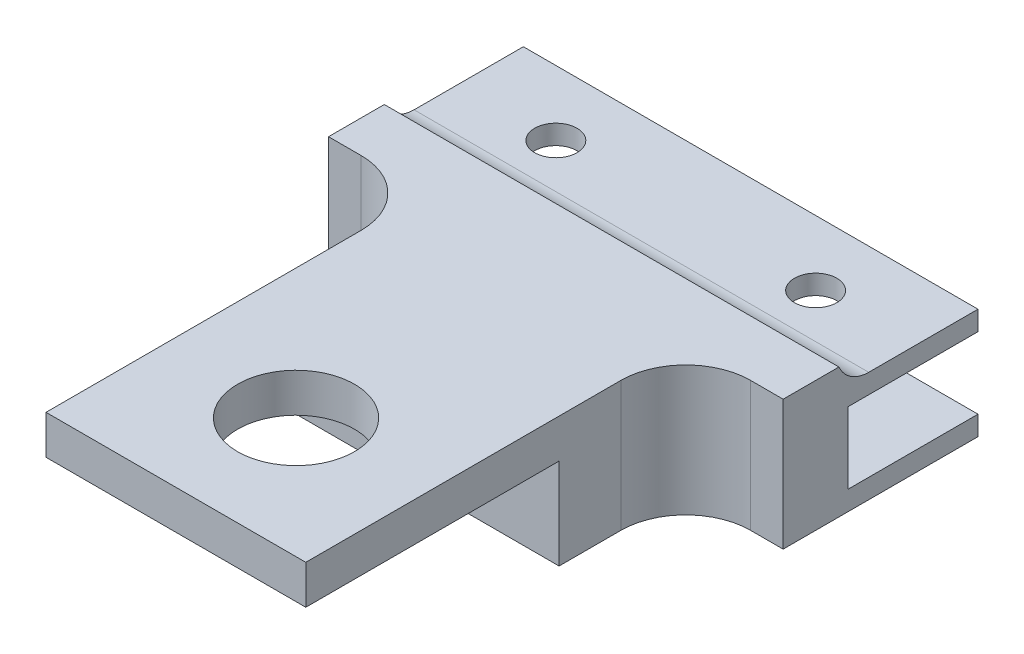
from build123d import *

# Parameters (mm, degrees)
SKETCH1_W                = 40
SKETCH1_H                = 11
BOSS_EXTRUDE1_DEPTH      = 19.5
SKETCH2_W                = 70
SKETCH2_H                = 11
BOSS_EXTRUDE2_DEPTH      = 10
SKETCH3_W                = 70
SKETCH3_H                = 20
SKETCH3_W_2              = 40
SKETCH3_H_2              = 19.5
BOSS_EXTRUDE4_DEPTH      = 3
SKETCH4_W                = 70
SKETCH4_H                = 30
SKETCH4_W_2              = 40
SKETCH4_H_2              = 19.5
BOSS_EXTRUDE5_DEPTH      = 3
SKETCH5_R                = 3.264523149
CUT_EXTRUDE1_DEPTH       = 50.132473986
BOSS_EXTRUDE6_DEPTH      = 3
BOSS_EXTRUDE6_DEPTH_BACK = 3
SKETCH6_W                = 40
SKETCH6_H                = 19.5
SKETCH6_H_2              = 39
SKETCH6_R                = 9
FILLET1_R                = 5
FILLET2_R                = 10


with BuildPart() as part:
    # Sketch1 → Boss-Extrude1 (new body)
    with BuildSketch(Plane.XY):
        Rectangle(SKETCH1_W, SKETCH1_H)
    extrude(amount=BOSS_EXTRUDE1_DEPTH)

    # Sketch2 → Boss-Extrude2 (add)
    with BuildSketch(Plane(origin=(0, 0, 0), x_dir=(-1, 0, 0), z_dir=(0, 0, -1))):
        Rectangle(SKETCH2_W, SKETCH2_H)
    extrude(amount=BOSS_EXTRUDE2_DEPTH)

    # Sketch3 → Boss-Extrude4 (add)
    with BuildSketch(Plane(origin=(0, 5.5, 0), x_dir=(1, 0, 0), z_dir=(0, 1, 0))):
        with Locations((0, 20)):
            Rectangle(SKETCH3_W, SKETCH3_H)
        Polygon((-35, 10), (-35, 0), (-20, 0), (20, 0), (35, 0), (35, 10), align=None)
        with Locations((0, -9.75)):
            Rectangle(SKETCH3_W_2, SKETCH3_H_2)
    extrude(amount=BOSS_EXTRUDE4_DEPTH)

    # Sketch4 → Boss-Extrude5 (add)
    with BuildSketch(Plane.XZ.offset(5.5)):
        with Locations((0, -15)):
            Rectangle(SKETCH4_W, SKETCH4_H)
        with Locations((0, 9.75)):
            Rectangle(SKETCH4_W_2, SKETCH4_H_2)
    extrude(amount=BOSS_EXTRUDE5_DEPTH)

    # Sketch5 → Cut-Extrude1 (cut, through all)
    with BuildSketch(Plane.XZ.offset(8.5)):
        with Locations(Location((-20, -20, 0), (0, 0, 270))):
            Circle(SKETCH5_R)
        with Locations(Location((20, -20, 0), (0, 0, 270))):
            Circle(SKETCH5_R)
    extrude(amount=-CUT_EXTRUDE1_DEPTH, mode=Mode.SUBTRACT)

    # Sketch6 → Boss-Extrude6 (add, two sides: drawn at the far end of the back side and taken through both)
    # profile 1 of 3: a face of its own
    with BuildSketch(Plane(origin=(0, 8.5, 0), x_dir=(1, 0, 0), z_dir=(0, 1, 0)).offset(-BOSS_EXTRUDE6_DEPTH_BACK)):
        Polygon((-20, 0), (20, 0), (35, 0), (35, 8.588079042), (-35, 8.588079042), (-35, 0), align=None)
    # profile 2 of 3: a face of its own
    with BuildSketch(Plane(origin=(0, 8.5, 0), x_dir=(1, 0, 0), z_dir=(0, 1, 0)).offset(-BOSS_EXTRUDE6_DEPTH_BACK)):
        with Locations((0, -9.75)):
            Rectangle(SKETCH6_W, SKETCH6_H)
    # profile 3 of 3: a face of its own
    with BuildSketch(Plane(origin=(0, 8.5, 0), x_dir=(1, 0, 0), z_dir=(0, 1, 0)).offset(-BOSS_EXTRUDE6_DEPTH_BACK)):
        with Locations((0, -39)):
            Rectangle(SKETCH6_W, SKETCH6_H_2)
        with Locations(Location((0, -40, 0), (0, 0, 270))):
            Circle(SKETCH6_R, mode=Mode.SUBTRACT)
    extrude(amount=BOSS_EXTRUDE6_DEPTH + BOSS_EXTRUDE6_DEPTH_BACK)

    # Fillet1
    # the kernel refuses this fillet: 5 mm, written as the material it adds along each edge
    with BuildSketch(Plane(origin=(-35, 8.5, -8.588079042), x_dir=(0, 0, -1), z_dir=(1, 0, 0))) as fillet1_piece_1:
        with BuildLine():
            CenterArc((4.582575695, 5), FILLET1_R, 203.578178478, 66.421821522)
            Line((0, 3), (-0.091651514, 2.96))
            ThreePointArc((-0.091651514, 2.96), (-0.1, 1.5), (-0.1, 0))
            Line((-0.1, 0), (0, -0.1))
            Line((0, -0.1), (4.582575695, -0.1))
            Line((4.582575695, -0.1), (4.582575695, 0))
        make_face()
    extrude(amount=70)

    # Fillet2
    fillet2_edges = [part.edges().sort_by_distance(p)[0] for p in [
        (-20, 1.5, 0),
        (20, 1.5, 0),
    ]]
    fillet(fillet2_edges, radius=FILLET2_R)


solid = part.part
